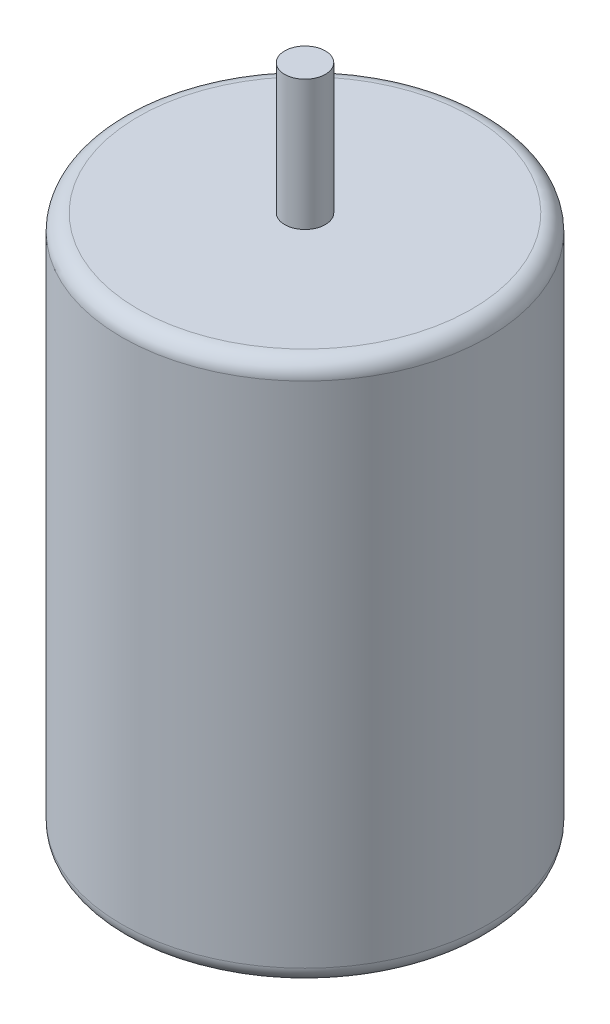
from build123d import *

# Parameters (mm, degrees)
SKETCH_1_R      = 22.5
EXTRUDE_1_DEPTH = 66.5
SKETCH_2_R      = 2.5
EXTRUDE_2_DEPTH = 16
FILLET_1_R      = 2


with BuildPart() as part:
    # 草圖1 → 填料-伸長1 (new body)
    with BuildSketch(Plane(origin=(0, 0, 0), x_dir=(1, 0, 0), z_dir=(0, 1, 0))):
        Circle(SKETCH_1_R)
    extrude(amount=EXTRUDE_1_DEPTH)

    # 草圖2 → 填料-伸長2 (add)
    with BuildSketch(Plane(origin=(0, 66.5, 0), x_dir=(1, 0, 0), z_dir=(0, 1, 0))):
        Circle(SKETCH_2_R)
    extrude(amount=EXTRUDE_2_DEPTH)

    # 圓角1
    fillet_1_edges = [part.edges().sort_by_distance(p)[0] for p in [
        (-22.5, 0, 0),
        (-22.5, 66.5, 0),
    ]]
    fillet(fillet_1_edges, radius=FILLET_1_R)


solid = part.part
